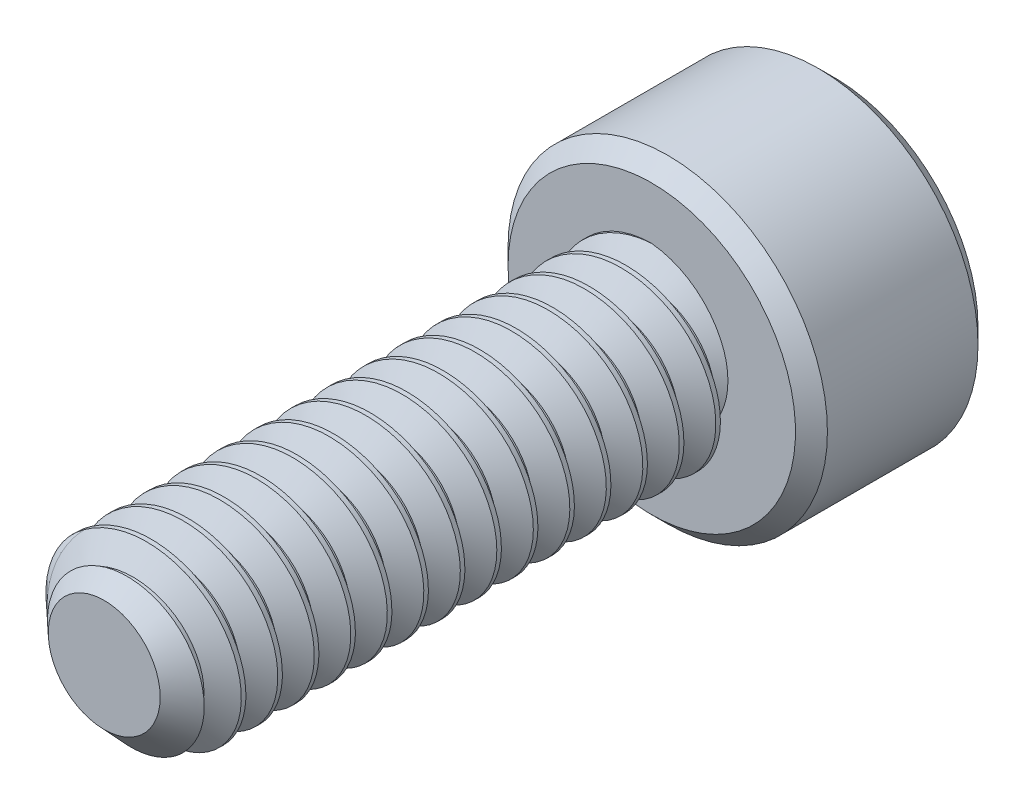
from build123d import *

# Parameters (mm, degrees)
SKETCH1_R          = 2
EXTRUDE1_DEPTH     = 12
CUT_SWEEP1_PITCH   = 0.8
SKETCH6_R          = 3.5
EXTRUDE2_DEPTH     = 4
CUT_EXTRUDE1_DEPTH = 2.25
CHAMFER1_SIZE      = 0.35


with BuildPart() as part:
    # Sketch1 → Extrude1 (new body)
    with BuildSketch(Plane.XY):
        Circle(SKETCH1_R)
    extrude(amount=-EXTRUDE1_DEPTH)

    # Cut-Sweep1: the profile of Sketch3 profile screwed along a right-hand helix of 16 turns, 6 arcs to a turn; built about Z, then put on its axis
    cut_sweep1_z = Axis((0, 0, 0), (0, 0, 1))
    cut_sweep1_corners = [(2.0003, 0, -0.700173205), (1.480384758, 0, -0.4), (1.480384758, 0, -0.3), (2.0003, 0, 0.000173205)]
    with BuildLine(mode=Mode.PRIVATE) as cut_sweep1_profile:
        Line(cut_sweep1_corners[0], cut_sweep1_corners[1])
        Line(cut_sweep1_corners[1], cut_sweep1_corners[2])
        Line(cut_sweep1_corners[2], cut_sweep1_corners[3])
        Line(cut_sweep1_corners[3], cut_sweep1_corners[0])
    cut_sweep1_cap = Face(cut_sweep1_profile.wire())
    cut_sweep1_turn_angles = [0, 30, 60, 90, 120, 150, 180, 210, 240, 270, 300, 330, 360]
    cut_sweep1_turn_weights = [1, 0.8660254037844387, 1, 0.8660254037844387, 1, 0.8660254037844387, 1, 0.8660254037844387, 1, 0.8660254037844387, 1, 0.8660254037844387, 1]
    cut_sweep1_turn_rails = [Edge.make_bspline([Vector(p[0], p[1], 0).rotate(cut_sweep1_z, cut_sweep1_turn_angles[k]) / cut_sweep1_turn_weights[k] + Vector(0, 0, p[2] + CUT_SWEEP1_PITCH * cut_sweep1_turn_angles[k] / 360) for k in range(13)], [0, 0, 0, 1, 1, 2, 2, 3, 3, 4, 4, 5, 5, 6, 6, 6], 2, cut_sweep1_turn_weights) for p in cut_sweep1_corners]
    cut_sweep1_turn_sides = [Face.make_surface_from_curves(cut_sweep1_turn_rails[p[0]], cut_sweep1_turn_rails[p[1]]) for p in [(0, 1), (1, 2), (2, 3), (3, 0)]]
    cut_sweep1 = Plane(origin=(0, 0, 0), x_dir=(0, 1, 0), z_dir=(0, 0, -1)) * Solid(Shell([*[p.moved(Location((0, 0, CUT_SWEEP1_PITCH * i))) for i in range(16) for p in cut_sweep1_turn_sides], cut_sweep1_cap, cut_sweep1_cap.rotate(cut_sweep1_z, 5760).moved(Location((0, 0, CUT_SWEEP1_PITCH * 5760 / 360)))]))
    add(cut_sweep1, mode=Mode.SUBTRACT)

    # Sketch4 → Cut-Revolve1 (revolve, cut)
    with BuildSketch(Plane(origin=(0, 0, 0), x_dir=(0, 0, -1), z_dir=(1, 0, 0)), mode=Mode.PRIVATE) as cut_revolve1_sk:
        Polygon((0.721407884, 2), (0, 1.226384758), (0, 2), align=None)
    revolve(cut_revolve1_sk.sketch.rotate(Axis((0, 0, 0), (0, 0, -1)), 279.239351729), axis=Axis((0, 0, 0), (0, 0, -1)), mode=Mode.SUBTRACT)

    # Sketch6 → Extrude2 (add)
    with BuildSketch(Plane(origin=(0, 0, -12), x_dir=(-1, 0, 0), z_dir=(0, 0, -1))):
        Circle(SKETCH6_R)
    extrude(amount=EXTRUDE2_DEPTH)

    # Sketch7 → Cut-Extrude1 (cut)
    with BuildSketch(Plane(origin=(0, 0, -16), x_dir=(-1, 0, 0), z_dir=(0, 0, -1))):
        Polygon((0, 1.732050808), (-1.5, 0.866025404), (-1.5, -0.866025404), (0, -1.732050808), (1.5, -0.866025404), (1.5, 0.866025404), align=None)
    extrude(amount=-CUT_EXTRUDE1_DEPTH, mode=Mode.SUBTRACT)

    # Cut-Extrude2 cone 1 section (through the dimple's axis) → Cut-Extrude2 (revolve, cut)
    with BuildSketch(Plane(origin=(0, 0, -16), x_dir=(0, 1, 0), z_dir=(1, 0, 0))):
        Polygon((0, 0), (1.732050808, 0), (0, 1.732050808), align=None)
    revolve(axis=Axis((0, 0, -16), (0, 0, 1)), mode=Mode.SUBTRACT)

    # Chamfer1
    chamfer1_edges = [part.edges().sort_by_distance(p)[0] for p in [
        (3.5, 0, -12),
        (3.5, 0, -16),
    ]]
    chamfer(chamfer1_edges, length=CHAMFER1_SIZE)


solid = part.part
